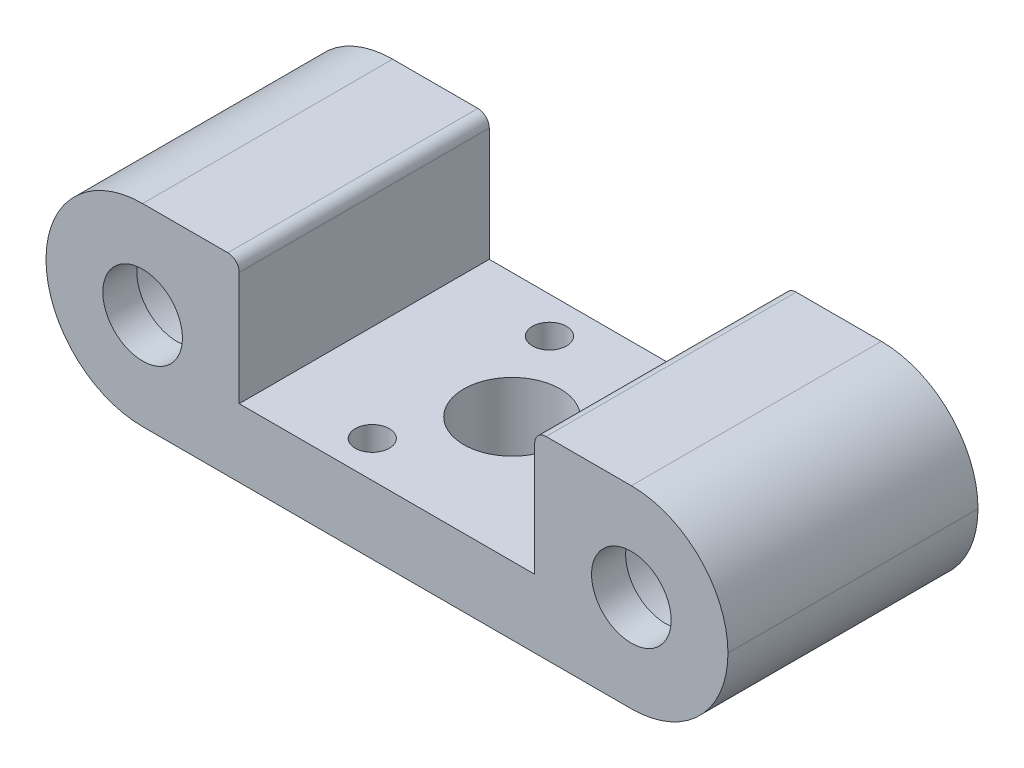
from build123d import *

# Parameters (mm, degrees)
BOSS_EXTRU_1_DEPTH      = 22
ESQUISSE3_R             = 6.1
ENL_V_MAT_EXTRU_1_DEPTH = 41.902322672
ESQUISSE4_R             = 4.25
ENL_V_MAT_EXTRU_2_DEPTH = 41.902322672
CONG_1_R                = 8.5
ESQUISSE5_R             = 1.5
ENL_V_MAT_EXTRU_3_DEPTH = 39.794329483
ESQUISSE6_R             = 6.25
ESQUISSE6_R_2           = 3.5
BOSS_EXTRU_2_DEPTH      = 3
CONG_2_R                = 1


with BuildPart() as part:
    # Esquisse2 → Boss.-Extru.1 (new body)
    with BuildSketch(Plane.XY):
        Polygon((-30, 0), (30, 0), (30, 17), (13, 17), (13, 6), (-13, 6), (-13, 17), (-30, 17), align=None)
    extrude(amount=BOSS_EXTRU_1_DEPTH)

    # Esquisse3 → Enlèv. mat.-Extru.1 (cut, through all)
    with BuildSketch(Plane.XY.offset(22)):
        with Locations((21.5, 8.5)):
            Circle(ESQUISSE3_R)
        with Locations(Location((-21.5, 8.5, 0), (0, 0, 180))):
            Circle(ESQUISSE3_R)
    extrude(amount=-ENL_V_MAT_EXTRU_1_DEPTH, mode=Mode.SUBTRACT)

    # Esquisse4 → Enlèv. mat.-Extru.2 (cut, through all)
    with BuildSketch(Plane(origin=(0, 0, 0), x_dir=(-1, 0, 0), z_dir=(0, -1, 0))):
        with Locations(Location((0, -11, 0), (0, 0, 90))):
            Circle(ESQUISSE4_R)
    extrude(amount=-ENL_V_MAT_EXTRU_2_DEPTH, mode=Mode.SUBTRACT)

    # Congé1
    cong_1_edges = [part.edges().sort_by_distance(p)[0] for p in [
        (30, 0, 11),
        (30, 17, 11),
        (-30, 0, 11),
        (-30, 17, 11),
    ]]
    fillet(cong_1_edges, radius=CONG_1_R - 0.0001)  # a hair under: the kernel refuses the full size

    # Esquisse5 → Enlèv. mat.-Extru.3 (cut, through all)
    with BuildSketch(Plane(origin=(0, 6, 0), x_dir=(1, 0, 0), z_dir=(0, 1, 0))):
        with Locations(Location((9, -11, 0), (0, 0, 270))):
            Circle(ESQUISSE5_R)
        with Locations(Location((-4.5, -18.794228634, 0), (0, 0, 270))):
            Circle(ESQUISSE5_R)
        with Locations(Location((-4.5, -3.205771366, 0), (0, 0, 270))):
            Circle(ESQUISSE5_R)
    extrude(amount=-ENL_V_MAT_EXTRU_3_DEPTH, mode=Mode.SUBTRACT)

    # Esquisse6 → Boss.-Extru.2 (add)
    # profile 1 of 2: a face of its own
    with BuildSketch(Plane.XY.offset(22)):
        with Locations((21.5, 8.5)):
            Circle(ESQUISSE6_R)
        with Locations((21.5, 8.5)):
            Circle(ESQUISSE6_R_2, mode=Mode.SUBTRACT)
    # profile 2 of 2: a face of its own
    with BuildSketch(Plane.XY.offset(22)):
        with Locations((-21.5, 8.5)):
            Circle(ESQUISSE6_R)
        with Locations(Location((-21.5, 8.5, 0), (0, 0, 180))):
            Circle(ESQUISSE6_R_2, mode=Mode.SUBTRACT)
    extrude(amount=-BOSS_EXTRU_2_DEPTH)

    # Congé2
    cong_2_edges = [part.edges().sort_by_distance(p)[0] for p in [
        (13, 17, 11),
        (-13, 17, 11),
    ]]
    fillet(cong_2_edges, radius=CONG_2_R)


solid = part.part
